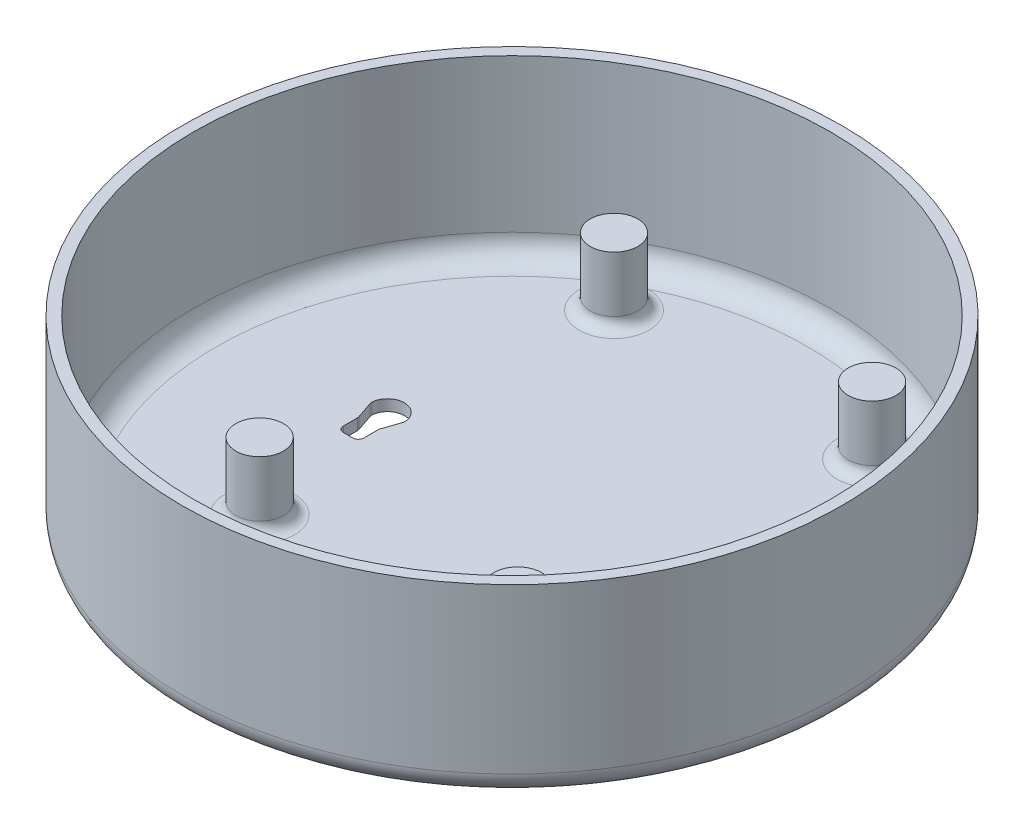
from build123d import *

# Parameters (mm, degrees)
SKETCH1_R           = 29.527
BOSS_EXTRUDE1_DEPTH = 16.698
SHELL1_T            = -1
CUT_EXTRUDE2_REACH  = 46.972
FILLET1_R           = 0.5
FILLET2_R           = 2
SKETCH6_R           = 2.1336
BOSS_EXTRUDE3_DEPTH = 6
FILLET4_R           = 1


with BuildPart() as part:
    # Sketch1 → Boss-Extrude1 (new body)
    with BuildSketch(Plane(origin=(0, 0, 0), x_dir=(1, 0, 0), z_dir=(0, 1, 0))):
        Circle(SKETCH1_R)
    extrude(amount=BOSS_EXTRUDE1_DEPTH)

    # Shell1
    shell1_openings = [part.faces().sort_by_distance(p)[0] for p in [
        (0, 16.698, 0),
    ]]
    offset(amount=SHELL1_T, openings=shell1_openings, kind=Kind.INTERSECTION)

    # Sketch4 → Cut-Extrude2 (cut, up to next)
    with BuildSketch(Plane.XZ, mode=Mode.PRIVATE) as cut_extrude2_sk1:
        with BuildLine():
            Line((12.2635, -2.613861326), (12.8385, -0.925))
            Line((12.8385, -0.925), (12.8385, 0.925))
            Line((12.8385, 0.925), (14.6885, 0.925))
            Line((14.6885, 0.925), (14.6885, -0.925))
            Line((14.6885, -0.925), (15.2635, -2.613861326))
            ThreePointArc((15.2635, -2.613861326), (13.7635, -4.113861326), (12.2635, -2.613861326))
        make_face()
    cut_extrude2_tool1 = extrude(cut_extrude2_sk1.sketch, amount=-CUT_EXTRUDE2_REACH, mode=Mode.PRIVATE) & part.part
    # Sketch4 → Cut-Extrude2 (cut, up to next)
    with BuildSketch(Plane.XZ, mode=Mode.PRIVATE) as cut_extrude2_sk2:
        with BuildLine():
            Line((-14.6885, 0.925), (-14.6885, -0.925))
            Line((-14.6885, -0.925), (-15.2635, -2.613861326))
            ThreePointArc((-15.2635, -2.613861326), (-13.7635, -4.113861326), (-12.2635, -2.613861326))
            Line((-12.2635, -2.613861326), (-12.8385, -0.925))
            Line((-12.8385, -0.925), (-12.8385, 0.925))
            Line((-12.8385, 0.925), (-14.6885, 0.925))
        make_face()
    cut_extrude2_tool2 = extrude(cut_extrude2_sk2.sketch, amount=-CUT_EXTRUDE2_REACH, mode=Mode.PRIVATE) & part.part
    add(cut_extrude2_tool1.solids().sort_by_distance((13.7635, 0, -1.719842))[0], mode=Mode.SUBTRACT)
    add(cut_extrude2_tool2.solids().sort_by_distance((-13.7635, 0, -1.719842))[0], mode=Mode.SUBTRACT)

    # Fillet1
    fillet1_edges = [part.edges().sort_by_distance(p)[0] for p in [
        (15.2635, 0.5, -2.613861326),
        (12.2635, 0.5, -2.613861326),
        (12.8385, 0.5, -0.925),
        (14.6885, 0.5, -0.925),
        (14.6885, 0.5, 0.925),
        (12.8385, 0.5, 0.925),
        (-15.2635, 0.5, -2.613861326),
        (-12.2635, 0.5, -2.613861326),
        (-12.8385, 0.5, -0.925),
        (-14.6885, 0.5, -0.925),
        (-12.8385, 0.5, 0.925),
        (-14.6885, 0.5, 0.925),
    ]]
    fillet(fillet1_edges, radius=FILLET1_R)

    # Fillet2
    fillet2_edges = [part.edges().sort_by_distance(p)[0] for p in [
        (-29.527, 0, 0),
        (-28.527, 1, 0),
    ]]
    fillet(fillet2_edges, radius=FILLET2_R)

    # Sketch6 → Boss-Extrude3 (add)
    with BuildSketch(Plane(origin=(0, 1, 0), x_dir=(1, 0, 0), z_dir=(0, 1, 0))):
        with Locations((-11.56, 20.7)):
            Circle(SKETCH6_R)
        with Locations((-11.56, -11.05)):
            Circle(SKETCH6_R)
        with Locations((11.56, 20.7)):
            Circle(SKETCH6_R)
        with Locations((11.56, -11.05)):
            Circle(SKETCH6_R)
    extrude(amount=BOSS_EXTRUDE3_DEPTH)

    # Fillet4
    fillet4_edges = [part.edges().sort_by_distance(p)[0] for p in [
        (-13.6936, 1, 11.05),
        (9.4264, 1, 11.05),
        (9.4264, 1, -20.7),
        (-13.6936, 1, -20.7),
    ]]
    fillet(fillet4_edges, radius=FILLET4_R)


solid = part.part
